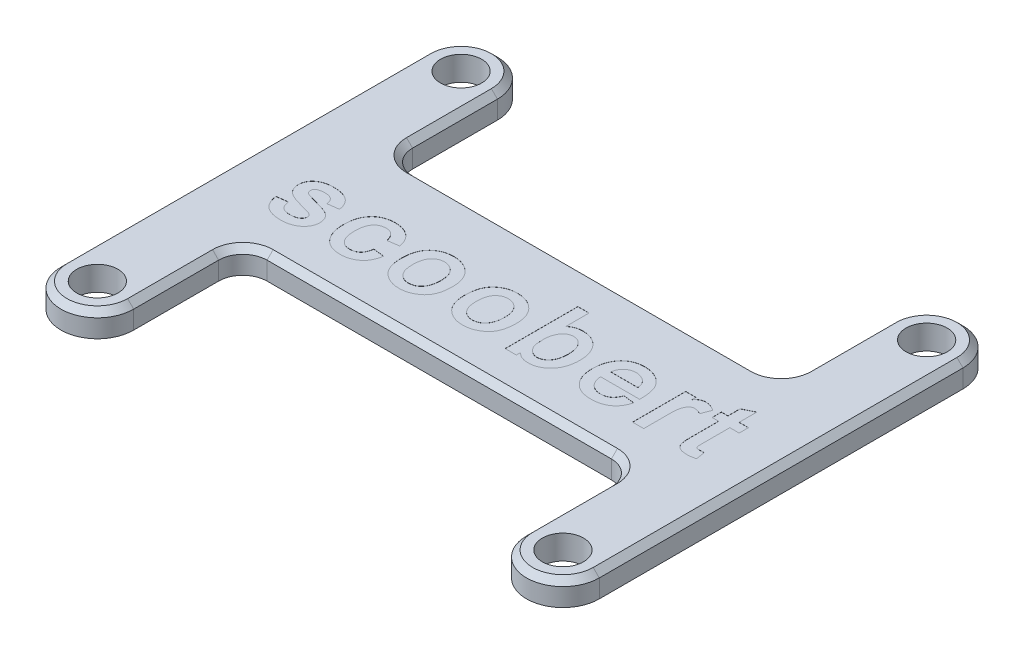
from build123d import *

# Parameters (mm, degrees)
SKETCH1_W            = 32.4
SKETCH1_H            = 12
BOSS_EXTRUDE1_DEPTH  = 2
M3_CLEARANCE_HOLE1_D = 3.4
CUT_EXTRUDE1_START   = -0.01
CUT_EXTRUDE1_DEPTH   = 0.01
FILLET1_R            = 2
CHAMFER1_SIZE        = 0.5


# Read off the part's stored shape, not the designer's step: Cut-Extrude1
with BuildPart() as part:
    # Sketch1 → Boss-Extrude1 (new body)
    with BuildSketch(Plane(origin=(0, 0, 0), x_dir=(1, 0, 0), z_dir=(0, 1, 0))):
        with BuildLine():
            Line((-16.2, 15), (-16.2, -15))
            ThreePointArc((-16.2, -15), (-19.2, -18), (-22.2, -15))
            Line((-22.2, -15), (-22.2, 15))
            ThreePointArc((-22.2, 15), (-19.2, 18), (-16.2, 15))
        make_face()
        with BuildLine():
            Line((22.2, 15), (22.2, -15))
            ThreePointArc((22.2, -15), (19.2, -18), (16.2, -15))
            Line((16.2, -15), (16.2, 15))
            ThreePointArc((16.2, 15), (19.2, 18), (22.2, 15))
        make_face()
        Rectangle(SKETCH1_W, SKETCH1_H)
    extrude(amount=BOSS_EXTRUDE1_DEPTH)

    # M3 Clearance Hole1 (through all)
    with Locations(Plane(origin=(0, 2, 0), x_dir=(1, 0, 0), z_dir=(0, 1, 0))):
        with Locations((-19.2, 15), (-19.2, -15), (19.2, -15), (19.2, 15)):
            Hole(M3_CLEARANCE_HOLE1_D / 2)

    # Cut-Extrude1 outline → Cut-Extrude1 (cut)
    # profile 1 of 8: a face of its own
    with BuildSketch(Plane(origin=(0, 2, 0), x_dir=(1, 0, 0), z_dir=(0, 1, 0)).offset(CUT_EXTRUDE1_START)):
        with BuildLine():
            add(Edge.make_bspline(
                [(18.196153846, -2.986778846), (18.125745356, -3.000612073), (17.993724125, -3.026550417), (17.807185791, -3.053850315), (17.646432842, -3.072291593), (17.547553699, -3.075476527), (17.502644231, -3.076923077)],
                knots=[0, 0, 0, 0, 0.30735575, 0.576315224, 0.807568536, 1, 1, 1, 1], degree=3))
            Line((18.196153846, -2.986778846), (18.079567308, -2.230769231))
            Line((18.079567308, -2.230769231), (17.608413462, -2.230769231))
            add(Edge.make_bspline(
                [(17.35, -1.733173077), (17.350088117, -1.780864019), (17.350247558, -1.867156231), (17.359872664, -1.982899235), (17.373040248, -2.071114025), (17.391420758, -2.137240573), (17.426970141, -2.182261302), (17.47529882, -2.211736815), (17.537730069, -2.227777466), (17.583478919, -2.229713845), (17.608413462, -2.230769231)],
                knots=[0, 0, 0, 0, 0.219094676, 0.396430928, 0.532618118, 0.629836366, 0.707174892, 0.789911788, 0.885495409, 1, 1, 1, 1], degree=3))
            Line((17.35, -1.733173077), (17.35, 0.615384615))
            Line((17.35, 0.615384615), (18.119230769, 0.615384615))
            Line((18.119230769, 0.615384615), (18.119230769, 1.384615385))
            Line((18.119230769, 1.384615385), (17.35, 1.384615385))
            Line((17.35, 1.384615385), (17.35, 2.846153846))
            Line((17.35, 2.846153846), (16.426923077, 2.385817308))
            Line((16.426923077, 2.385817308), (16.426923077, 1.384615385))
            Line((16.426923077, 1.384615385), (15.888461538, 1.384615385))
            Line((15.888461538, 1.384615385), (15.888461538, 0.615384615))
            Line((15.888461538, 0.615384615), (16.426923077, 0.615384615))
            Line((16.426923077, 0.615384615), (16.426923077, -1.717548077))
            add(Edge.make_bspline(
                [(17.502644231, -3.076923077), (17.462565767, -3.076570939), (17.384716784, -3.07588694), (17.271912496, -3.067511798), (17.167585044, -3.053172618), (17.071140805, -3.033908792), (16.982766298, -3.009502197), (16.902955745, -2.977803422), (16.830862594, -2.941863714), (16.747888679, -2.886411622), (16.658077319, -2.807748335), (16.574933149, -2.697606172), (16.510429322, -2.577822429), (16.475048389, -2.441912786), (16.453490797, -2.291036938), (16.438453569, -2.120039462), (16.428964166, -1.926389507), (16.427628013, -1.789676186), (16.426923077, -1.717548077)],
                knots=[0, 0, 0, 0, 0.058671183, 0.113963746, 0.165480639, 0.212762487, 0.257884533, 0.299495549, 0.338321726, 0.37557856, 0.445385773, 0.511909316, 0.576714074, 0.64318846, 0.716195327, 0.799840086, 0.894398322, 1, 1, 1, 1], degree=3))
        make_face()
    # profile 2 of 8: a face of its own
    with BuildSketch(Plane(origin=(0, 2, 0), x_dir=(1, 0, 0), z_dir=(0, 1, 0)).offset(CUT_EXTRUDE1_START)):
        with BuildLine():
            add(Edge.make_bspline(
                [(14.527644231, 1.461538462), (14.562954335, 1.460625021), (14.634261771, 1.458780361), (14.741443108, 1.443191215), (14.849754512, 1.420989186), (14.958833026, 1.387609317), (15.069098393, 1.345965599), (15.180303841, 1.293260605), (15.292859841, 1.232577821), (15.366454674, 1.18594994), (15.403846154, 1.162259615)],
                knots=[0, 0, 0, 0, 0.112759791, 0.227714187, 0.345456957, 0.465733007, 0.591730783, 0.721722568, 0.858615007, 1, 1, 1, 1], degree=3))
            add(Edge.make_bspline(
                [(13.788461545, 1.057067242), (13.819065546, 1.098802401), (13.883267311, 1.179007235), (13.99591758, 1.279282725), (14.115650373, 1.363197003), (14.246423551, 1.418851414), (14.38412589, 1.456368229), (14.479312766, 1.459797326), (14.527644231, 1.461538462)],
                knots=[0.301065936, 0.301065936, 0.301065936, 0.301065936, 0.424683484, 0.54617366, 0.660770063, 0.772803698, 0.884640292, 1, 1, 1, 1], degree=3))
            Line((13.788461545, 1.057067242), (13.788461538, 1.384615385))
            Line((13.788461538, 1.384615385), (12.942307692, 1.384615385))
            Line((12.942307692, 1.384615385), (12.942307692, -3))
            Line((12.942307692, -3), (13.865384615, -3))
            Line((13.865384615, -3), (13.865384615, -0.735576923))
            add(Edge.make_bspline(
                [(14.503605769, 0.538461538), (14.48069565, 0.537560324), (14.435606301, 0.535786645), (14.369313192, 0.520914471), (14.306647495, 0.495329435), (14.247082751, 0.460093777), (14.191479816, 0.414569167), (14.137926664, 0.360311243), (14.089287256, 0.294414214), (14.042111185, 0.220200728), (14.000046604, 0.135709542), (13.964235371, 0.040916338), (13.933090467, -0.063463224), (13.907904458, -0.178363787), (13.889408805, -0.303325854), (13.874719973, -0.438408325), (13.866430779, -0.583628775), (13.865740521, -0.683884031), (13.865384615, -0.735576923)],
                knots=[0, 0, 0, 0, 0.043735157, 0.086075055, 0.128998979, 0.17257982, 0.217764425, 0.265936074, 0.317831173, 0.373893867, 0.43379598, 0.497760804, 0.567260744, 0.641729199, 0.722267439, 0.808483004, 0.901251389, 1, 1, 1, 1], degree=3))
            add(Edge.make_bspline(
                [(15.111778846, 0.384615385), (15.051158748, 0.407865811), (14.938205758, 0.451188161), (14.77577269, 0.500038777), (14.633408989, 0.53138652), (14.544192254, 0.536249343), (14.503605769, 0.538461538)],
                knots=[0, 0, 0, 0, 0.308816844, 0.575416191, 0.806848297, 1, 1, 1, 1], degree=3))
            Line((15.111778846, 0.384615385), (15.403846154, 1.162259615))
        make_face()
    # profile 3 of 8: a face of its own
    with BuildSketch(Plane(origin=(0, 2, 0), x_dir=(1, 0, 0), z_dir=(0, 1, 0)).offset(CUT_EXTRUDE1_START)):
        with BuildLine():
            add(Edge.make_bspline(
                [(9.529807692, 1.461538462), (9.614490114, 1.458558634), (9.783226966, 1.452621076), (10.033546062, 1.411082742), (10.278106145, 1.339883115), (10.476885492, 1.260208874), (10.630590258, 1.180220007), (10.742194258, 1.112063523), (10.84872089, 1.034975674), (10.948849022, 0.947295943), (11.04440842, 0.851727828), (11.135451375, 0.747530563), (11.220619811, 0.63403262), (11.302287288, 0.511011459), (11.376375927, 0.374045925), (11.440553207, 0.220025394), (11.49194286, 0.047221414), (11.537091755, -0.142799525), (11.569133296, -0.3511195), (11.595105755, -0.57676334), (11.608868006, -0.820741997), (11.61062787, -0.989568602), (11.611538462, -1.076923077)],
                knots=[0, 0, 0, 0, 0.067912518, 0.135321409, 0.20285503, 0.271896253, 0.306678357, 0.341729578, 0.376695261, 0.412003314, 0.4483589, 0.485026994, 0.522881184, 0.562096639, 0.603361131, 0.647582606, 0.69566042, 0.74780586, 0.804121275, 0.864589766, 0.929935866, 1, 1, 1, 1], degree=3))
            add(Edge.make_bspline(
                [(7.457692308, -0.838942308), (7.459264578, -0.755949355), (7.46234078, -0.593570656), (7.487705253, -0.355509995), (7.531163465, -0.12981827), (7.589496571, 0.085015007), (7.667129368, 0.28692885), (7.759294313, 0.47849338), (7.870795474, 0.656856516), (7.997799466, 0.822821586), (8.140133029, 0.973170366), (8.297949128, 1.104192318), (8.469540426, 1.215685043), (8.655513303, 1.305692385), (8.854762428, 1.375811982), (9.067406893, 1.42611142), (9.294144169, 1.456607618), (9.449983197, 1.459868275), (9.529807692, 1.461538462)],
                knots=[0, 0, 0, 0, 0.071176592, 0.139259563, 0.205039946, 0.268154111, 0.329935027, 0.390336664, 0.450222865, 0.510022234, 0.569331802, 0.627412013, 0.685557253, 0.744422114, 0.804201731, 0.866382775, 0.931558046, 1, 1, 1, 1], degree=3))
            add(Edge.make_bspline(
                [(9.582692308, -3.076923077), (9.501680554, -3.075086809), (9.343973478, -3.071512111), (9.113833592, -3.043418459), (8.897074757, -2.997279577), (8.694110828, -2.930924117), (8.5046358, -2.846149508), (8.32828354, -2.742903053), (8.166488587, -2.618946621), (8.018208844, -2.47825803), (7.886202696, -2.320824638), (7.771590058, -2.148815788), (7.67335345, -1.963903547), (7.594202382, -1.764665211), (7.533231363, -1.551941342), (7.488844336, -1.326437029), (7.46193097, -1.087193764), (7.459130052, -0.923148642), (7.457692308, -0.838942308)],
                knots=[0, 0, 0, 0, 0.06949348, 0.135284239, 0.198596335, 0.259363704, 0.318141236, 0.376389648, 0.434279905, 0.49263574, 0.551438397, 0.610168664, 0.669679457, 0.730768779, 0.793759027, 0.859287927, 0.9277708, 1, 1, 1, 1], degree=3))
            add(Edge.make_bspline(
                [(11.611538462, -1.573317308), (11.594725922, -1.633263809), (11.56175183, -1.750835659), (11.499389297, -1.919554744), (11.425431292, -2.076300123), (11.342874661, -2.223176203), (11.24721485, -2.357605417), (11.142451343, -2.482400742), (11.026947967, -2.595569084), (10.900954028, -2.696718886), (10.766547248, -2.787771781), (10.62136324, -2.863589261), (10.469794923, -2.931001324), (10.308372091, -2.983212062), (10.138982817, -3.025569839), (9.960924696, -3.055085967), (9.774596889, -3.073715879), (9.647642078, -3.075837606), (9.582692308, -3.076923077)],
                knots=[0, 0, 0, 0, 0.067900411, 0.133171693, 0.195932081, 0.256809188, 0.316710504, 0.375636076, 0.434357073, 0.492784578, 0.551695561, 0.611134311, 0.671220292, 0.73244625, 0.795940402, 0.861540081, 0.929164245, 1, 1, 1, 1], degree=3))
            Line((11.611538462, -1.573317308), (10.713701923, -1.461538462))
            add(Edge.make_bspline(
                [(9.588701923, -2.307692308), (9.654212093, -2.305722996), (9.780380665, -2.301930222), (9.961100914, -2.263327925), (10.125329922, -2.202249315), (10.274834049, -2.115291002), (10.408486557, -1.99786759), (10.526665055, -1.848582918), (10.629978523, -1.66710463), (10.684848805, -1.532381559), (10.713701923, -1.461538462)],
                knots=[0, 0, 0, 0, 0.129297712, 0.249019467, 0.363278463, 0.474354938, 0.588833178, 0.712731131, 0.848941861, 1, 1, 1, 1], degree=3))
            add(Edge.make_bspline(
                [(8.380769231, -1.076923077), (8.385371046, -1.124270639), (8.394383096, -1.216994613), (8.417865823, -1.35194919), (8.452836017, -1.478086238), (8.496984408, -1.595941699), (8.547296758, -1.707049274), (8.610902697, -1.808123475), (8.682234219, -1.901746716), (8.762438663, -1.986731249), (8.849877572, -2.061819445), (8.942145088, -2.127913653), (9.039590518, -2.182681776), (9.140647735, -2.228988383), (9.246354222, -2.263896204), (9.35620192, -2.288973185), (9.470821357, -2.305378051), (9.548981396, -2.306912506), (9.588701923, -2.307692308)],
                knots=[0, 0, 0, 0, 0.074432489, 0.145766241, 0.214065027, 0.278936559, 0.342609268, 0.404551339, 0.465372629, 0.526580499, 0.587038751, 0.645493618, 0.703898024, 0.761703673, 0.819202477, 0.877758134, 0.937877316, 1, 1, 1, 1], degree=3))
            Line((8.380769231, -1.076923077), (11.611538462, -1.076923077))
        make_face()
        with BuildLine():
            add(Edge.make_bspline(
                [(9.551442308, 0.692307692), (9.515751778, 0.69128566), (9.445327865, 0.689269005), (9.341761677, 0.676259109), (9.242583124, 0.652840649), (9.14720905, 0.62212276), (9.056321684, 0.580611326), (8.969845283, 0.530135728), (8.887703147, 0.47054634), (8.809778295, 0.403712691), (8.738613008, 0.329718581), (8.674025885, 0.251365414), (8.61903253, 0.167878375), (8.570408277, 0.080876715), (8.529531756, -0.010338509), (8.497022888, -0.105696905), (8.472711389, -0.205109702), (8.462751473, -0.273137443), (8.457692308, -0.307692308)],
                knots=[0, 0, 0, 0, 0.065886775, 0.130006601, 0.192256692, 0.253764315, 0.314664265, 0.376309564, 0.438295509, 0.501746509, 0.565554231, 0.62757987, 0.688909391, 0.74982281, 0.811397089, 0.873139908, 0.935561094, 1, 1, 1, 1], degree=3))
            add(Edge.make_bspline(
                [(10.688461538, -0.307692308), (10.683892328, -0.267540469), (10.67501287, -0.189512412), (10.651348648, -0.076429116), (10.615781713, 0.0282376), (10.573133537, 0.126292428), (10.519577099, 0.216151115), (10.4565886, 0.297948511), (10.385261923, 0.373845002), (10.277073905, 0.461097017), (10.131712964, 0.552881002), (9.94569467, 0.6331586), (9.751227156, 0.683779015), (9.618249107, 0.689455756), (9.551442308, 0.692307692)],
                knots=[0, 0, 0, 0, 0.072427089, 0.140749346, 0.206615136, 0.270278603, 0.332112927, 0.393595868, 0.455066223, 0.518335486, 0.642279128, 0.761956143, 0.880409223, 1, 1, 1, 1], degree=3))
            Line((10.688461538, -0.307692308), (8.457692308, -0.307692308))
        make_face(mode=Mode.SUBTRACT)
    # profile 4 of 8: a face of its own
    with BuildSketch(Plane(origin=(0, 2, 0), x_dir=(1, 0, 0), z_dir=(0, 1, 0)).offset(CUT_EXTRUDE1_START)):
        with BuildLine():
            add(Edge.make_bspline(
                [(3.357692317, 1.076582455), (3.374429381, 1.093239936), (3.432390212, 1.147530075), (3.53977519, 1.229432137), (3.683335247, 1.3169898), (3.841272086, 1.380828785), (4.009997495, 1.428531112), (4.191332253, 1.4560142), (4.316335076, 1.459664098), (4.380528846, 1.461538462)],
                knots=[0.197370765, 0.197370765, 0.197370765, 0.197370765, 0.247983839, 0.367503663, 0.48664252, 0.60767117, 0.731793492, 0.862265617, 1, 1, 1, 1], degree=3))
            Line((3.357692317, 1.076582455), (3.357692308, 3))
            Line((3.357692308, 3), (2.434615385, 3))
            Line((2.434615385, 3), (2.434615385, -3))
            Line((2.434615385, -3), (3.357692308, -3))
            Line((3.357692308, -3), (3.357692306, -2.639333598))
            add(Edge.make_bspline(
                [(4.378125, -3.076923077), (4.314296359, -3.074846379), (4.189846678, -3.070797344), (4.009085489, -3.039220579), (3.840637468, -2.98602192), (3.683703979, -2.912325767), (3.539206601, -2.816250357), (3.433274157, -2.721080107), (3.375174559, -2.659088756), (3.357692306, -2.639333598)],
                knots=[0, 0, 0, 0, 0.133032983, 0.259380619, 0.381172564, 0.500372988, 0.619690435, 0.741576881, 0.796524826, 0.796524826, 0.796524826, 0.796524826], degree=3))
            add(Edge.make_bspline(
                [(6.357692308, -0.740384615), (6.355716656, -0.829787039), (6.351871547, -1.003786404), (6.325824367, -1.257180701), (6.280063108, -1.495191827), (6.216533261, -1.718606142), (6.134960143, -1.927393478), (6.03493787, -2.120991335), (5.916176847, -2.298937853), (5.780978847, -2.460841429), (5.631552763, -2.603434861), (5.476707464, -2.732124903), (5.311167982, -2.837310223), (5.138994066, -2.924928525), (4.959928887, -2.993872207), (4.772406561, -3.042042343), (4.577783746, -3.071503509), (4.445135278, -3.075104139), (4.378125, -3.076923077)],
                knots=[0, 0, 0, 0, 0.078111, 0.152023445, 0.222254175, 0.289618252, 0.354686773, 0.417781959, 0.479625708, 0.541252118, 0.601655497, 0.65987939, 0.716877111, 0.772608504, 0.828451916, 0.884148121, 0.941474886, 1, 1, 1, 1], degree=3))
            add(Edge.make_bspline(
                [(4.380528846, 1.461538462), (4.455137884, 1.459736632), (4.601329369, 1.456206067), (4.814525716, 1.427280976), (5.015207974, 1.378101447), (5.203354892, 1.30888856), (5.379549547, 1.221287219), (5.543509804, 1.11325721), (5.694282532, 0.984805275), (5.831801917, 0.838307306), (5.955067601, 0.677212182), (6.063968913, 0.505529489), (6.153815062, 0.322469976), (6.229550536, 0.13024977), (6.2861602, -0.073372957), (6.328928835, -0.286557163), (6.3526848, -0.510277212), (6.355999748, -0.662607287), (6.357692308, -0.740384615)],
                knots=[0, 0, 0, 0, 0.067186761, 0.131648023, 0.193355222, 0.252954891, 0.311863299, 0.370217491, 0.42936419, 0.48986931, 0.55086323, 0.611840065, 0.672685402, 0.734274295, 0.797676238, 0.862789823, 0.929942653, 1, 1, 1, 1], degree=3))
        make_face()
        with BuildLine():
            add(Edge.make_bspline(
                [(3.357692308, -0.775240385), (3.358215846, -0.827730047), (3.359227306, -0.929138549), (3.365160912, -1.075041488), (3.374618763, -1.20853497), (3.387392205, -1.329748968), (3.405210268, -1.438481007), (3.426805013, -1.535211251), (3.45121021, -1.620085037), (3.491505752, -1.715734892), (3.552565007, -1.821275707), (3.634858553, -1.938636685), (3.734259306, -2.041549267), (3.841384087, -2.13578245), (3.960371518, -2.211065059), (4.084930324, -2.267759708), (4.215316124, -2.301389134), (4.303821507, -2.305591164), (4.348076923, -2.307692308)],
                knots=[0, 0, 0, 0, 0.076848547, 0.148469156, 0.213746393, 0.272756373, 0.32685378, 0.374951845, 0.417819038, 0.455945553, 0.526591556, 0.595937447, 0.665233707, 0.735535528, 0.804365996, 0.87053318, 0.935262604, 1, 1, 1, 1], degree=3))
            add(Edge.make_bspline(
                [(4.372115385, 0.692307692), (4.337160859, 0.691311161), (4.268300906, 0.689348008), (4.167412795, 0.668959756), (4.070585363, 0.637607588), (3.977243401, 0.594354491), (3.888791088, 0.536744195), (3.804631861, 0.466827811), (3.725241641, 0.384011494), (3.649457212, 0.290973034), (3.581992907, 0.186552298), (3.52068308, 0.074198043), (3.471273899, -0.047590131), (3.428308893, -0.177021334), (3.396546103, -0.315108117), (3.373663129, -0.461296965), (3.360621824, -0.615547687), (3.358684952, -0.721129744), (3.357692308, -0.775240385)],
                knots=[0, 0, 0, 0, 0.052838328, 0.104090807, 0.155095211, 0.20663382, 0.259276966, 0.314396929, 0.371855118, 0.432649243, 0.495714076, 0.559736443, 0.626060352, 0.694321033, 0.765945785, 0.840211496, 0.918108639, 1, 1, 1, 1], degree=3))
            add(Edge.make_bspline(
                [(5.434615385, -0.801682692), (5.433669889, -0.745163199), (5.431829856, -0.635170476), (5.418209634, -0.474662791), (5.397431046, -0.323515152), (5.366192211, -0.181561462), (5.32462669, -0.049441719), (5.277838673, 0.074896557), (5.219243568, 0.189012281), (5.152246852, 0.293149068), (5.078230011, 0.387028906), (4.996932662, 0.468779306), (4.9086709, 0.537399656), (4.814360354, 0.595034387), (4.712446545, 0.63804827), (4.604757659, 0.669270007), (4.490654748, 0.689434162), (4.412266505, 0.691334383), (4.372115385, 0.692307692)],
                knots=[0, 0, 0, 0, 0.082299418, 0.160163098, 0.234424044, 0.304352796, 0.371528034, 0.435995859, 0.497576692, 0.557943234, 0.616077722, 0.67136087, 0.725398462, 0.778530785, 0.831851775, 0.88594918, 0.941582205, 1, 1, 1, 1], degree=3))
            add(Edge.make_bspline(
                [(4.348076923, -2.307692308), (4.386200608, -2.306542385), (4.461284406, -2.304277636), (4.571672121, -2.286173924), (4.676508241, -2.254134887), (4.777542342, -2.212357908), (4.872667181, -2.15661191), (4.962277412, -2.088036019), (5.047775953, -2.008858383), (5.127358765, -1.917112406), (5.198808682, -1.813643507), (5.263552009, -1.700468052), (5.315593643, -1.575246041), (5.360566265, -1.440932538), (5.39370469, -1.29551654), (5.417490906, -1.140072397), (5.432027458, -0.974234464), (5.43373765, -0.860206234), (5.434615385, -0.801682692)],
                knots=[0, 0, 0, 0, 0.054953583, 0.108229926, 0.16068253, 0.212716771, 0.265524431, 0.319131706, 0.375128909, 0.433274838, 0.493849233, 0.556185598, 0.620886011, 0.689022871, 0.760203991, 0.83561231, 0.915630105, 1, 1, 1, 1], degree=3))
        make_face(mode=Mode.SUBTRACT)
    # profile 5 of 8: a face of its own
    with BuildSketch(Plane(origin=(0, 2, 0), x_dir=(1, 0, 0), z_dir=(0, 1, 0)).offset(CUT_EXTRUDE1_START)):
        with BuildLine():
            add(Edge.make_bspline(
                [(-3.05, -0.807692308), (-3.048202398, -0.715470583), (-3.044723629, -0.537000553), (-3.016612186, -0.27816859), (-2.971527436, -0.037235684), (-2.908736849, 0.186348205), (-2.824920372, 0.391174627), (-2.724086932, 0.578682002), (-2.604409795, 0.748361999), (-2.466823474, 0.899072942), (-2.314776114, 1.029673456), (-2.156274509, 1.147257247), (-1.985838622, 1.242947249), (-1.808687321, 1.324381961), (-1.621715881, 1.385339691), (-1.427153137, 1.430203507), (-1.223433454, 1.457127532), (-1.084535943, 1.460052081), (-1.013942308, 1.461538462)],
                knots=[0, 0, 0, 0, 0.080214474, 0.155233265, 0.226189928, 0.293265234, 0.356890246, 0.418338542, 0.478103057, 0.537069476, 0.595367677, 0.652256829, 0.708458474, 0.76508328, 0.821626501, 0.8792055, 0.938607086, 1, 1, 1, 1], degree=3))
            add(Edge.make_bspline(
                [(-1.013942308, -3.076923077), (-1.081325277, -3.07531706), (-1.214568968, -3.072141307), (-1.411051074, -3.046557888), (-1.600560847, -3.003239022), (-1.782858337, -2.942310577), (-1.959396645, -2.867051012), (-2.128680777, -2.772324506), (-2.290374397, -2.659849533), (-2.446580991, -2.533557499), (-2.588837551, -2.386709795), (-2.71380915, -2.219433218), (-2.81835766, -2.031602687), (-2.903706408, -1.824579322), (-2.969823591, -1.598094896), (-3.015391183, -1.352036573), (-3.045103921, -1.086460436), (-3.048330832, -0.902729734), (-3.05, -0.807692308)],
                knots=[0, 0, 0, 0, 0.05861417, 0.115904189, 0.172053382, 0.227501335, 0.282931753, 0.338797808, 0.395943413, 0.454145652, 0.513311791, 0.573339393, 0.635300473, 0.699843563, 0.767791173, 0.840191686, 0.917336783, 1, 1, 1, 1], degree=3))
            add(Edge.make_bspline(
                [(1.103846154, -0.740384615), (1.102230938, -0.841023688), (1.099114893, -1.035174769), (1.068853562, -1.315456453), (1.018855088, -1.573287776), (0.949896318, -1.810398895), (0.858157099, -2.024522967), (0.748767775, -2.218737998), (0.617023861, -2.389415442), (0.465213118, -2.536080791), (0.301315367, -2.662095984), (0.13198665, -2.773973231), (-0.044701083, -2.865863505), (-0.225873937, -2.944889482), (-0.415013533, -3.00229906), (-0.60920433, -3.046650638), (-0.809738129, -3.072101935), (-0.945363991, -3.075303983), (-1.013942308, -3.076923077)],
                knots=[0, 0, 0, 0, 0.084484379, 0.162985737, 0.236353139, 0.304795452, 0.369908212, 0.431540194, 0.491496675, 0.550258625, 0.608267478, 0.664907113, 0.720436851, 0.775301219, 0.830631879, 0.886133075, 0.942423945, 1, 1, 1, 1], degree=3))
            add(Edge.make_bspline(
                [(-1.013942308, 1.461538462), (-0.937733817, 1.459684854), (-0.788407709, 1.456052818), (-0.569962428, 1.427777764), (-0.362284133, 1.382349079), (-0.165031562, 1.318800361), (0.020920779, 1.23531726), (0.196212834, 1.133408961), (0.36193623, 1.014588661), (0.513876111, 0.875559588), (0.65342425, 0.722980922), (0.774831946, 0.554587092), (0.875421779, 0.371478756), (0.960352415, 0.176284025), (1.025372235, -0.033305038), (1.070248039, -0.256855692), (1.098420364, -0.494074528), (1.102008674, -0.656970089), (1.103846154, -0.740384615)],
                knots=[0, 0, 0, 0, 0.066337385, 0.12998425, 0.19143073, 0.251221099, 0.310087466, 0.368543103, 0.427505515, 0.487271456, 0.547530124, 0.607262461, 0.667538292, 0.729099525, 0.792319563, 0.858201382, 0.927388662, 1, 1, 1, 1], degree=3))
        make_face()
        with BuildLine():
            add(Edge.make_bspline(
                [(-2.126923077, -0.810096154), (-2.126153018, -0.872630318), (-2.124664564, -0.993503149), (-2.10897415, -1.168237144), (-2.082788391, -1.329736114), (-2.046616257, -1.478406612), (-2.002041436, -1.615257883), (-1.943791794, -1.738222534), (-1.876264998, -1.848838439), (-1.798973621, -1.946324428), (-1.714744985, -2.03170794), (-1.625831002, -2.105019443), (-1.533095398, -2.167165431), (-1.437288277, -2.219226315), (-1.336836005, -2.259248003), (-1.232267673, -2.286776801), (-1.124287149, -2.304010146), (-1.050864633, -2.306460225), (-1.013942308, -2.307692308)],
                knots=[0, 0, 0, 0, 0.089397978, 0.17279813, 0.250591186, 0.323120504, 0.39141776, 0.4559979, 0.517209873, 0.576349402, 0.63346772, 0.688407064, 0.740840056, 0.792870919, 0.844039973, 0.89503878, 0.947217659, 1, 1, 1, 1], degree=3))
            add(Edge.make_bspline(
                [(-1.013942308, 0.692307692), (-1.05206771, 0.691110208), (-1.127091828, 0.688753768), (-1.237070795, 0.671405092), (-1.3427925, 0.643813591), (-1.444265859, 0.60420326), (-1.540413629, 0.551337153), (-1.634004072, 0.490401369), (-1.721903383, 0.416176261), (-1.805032216, 0.330926101), (-1.881055989, 0.233372105), (-1.947712527, 0.122522859), (-2.004221135, -0.001123412), (-2.04766402, -0.138747052), (-2.084422421, -0.287924898), (-2.108411762, -0.450506785), (-2.12484936, -0.625862884), (-2.126214591, -0.747152824), (-2.126923077, -0.810096154)],
                knots=[0, 0, 0, 0, 0.054278405, 0.106810398, 0.158154632, 0.209647648, 0.261468368, 0.314164326, 0.368442731, 0.424931244, 0.483479906, 0.54414757, 0.608744656, 0.676586364, 0.749377187, 0.827329395, 0.910392709, 1, 1, 1, 1], degree=3))
            add(Edge.make_bspline(
                [(0.180769231, -0.782451923), (0.180166659, -0.722701885), (0.178999317, -0.606950045), (0.160899108, -0.439239327), (0.136014255, -0.282491735), (0.09694479, -0.137950921), (0.04905876, -0.004510495), (-0.009450299, 0.117884249), (-0.080906015, 0.227539733), (-0.161987167, 0.325543637), (-0.250782214, 0.411508776), (-0.344702316, 0.486910445), (-0.444546363, 0.549176901), (-0.54770668, 0.603647446), (-0.657826508, 0.642158508), (-0.771834479, 0.671973485), (-0.891258928, 0.688604002), (-0.972629019, 0.691060485), (-1.013942308, 0.692307692)],
                knots=[0, 0, 0, 0, 0.083682389, 0.16211522, 0.236138141, 0.305863357, 0.37157641, 0.434601155, 0.495489189, 0.55450556, 0.61247111, 0.668411082, 0.722924216, 0.777159101, 0.831504297, 0.885971154, 0.942105183, 1, 1, 1, 1], degree=3))
            add(Edge.make_bspline(
                [(-1.013942308, -2.307692308), (-0.966584955, -2.306812333), (-0.874200559, -2.305095685), (-0.740484489, -2.28383551), (-0.615379588, -2.251060294), (-0.497975399, -2.207971267), (-0.391389181, -2.146992279), (-0.291855163, -2.076629081), (-0.202262331, -1.991131614), (-0.122148753, -1.893271634), (-0.050015712, -1.78560141), (0.011291153, -1.667489057), (0.06413366, -1.541331844), (0.107748799, -1.406351363), (0.139319944, -1.262488841), (0.163697984, -1.110456995), (0.178129856, -0.949397174), (0.179875671, -0.838971227), (0.180769231, -0.782451923)],
                knots=[0, 0, 0, 0, 0.064755906, 0.126325373, 0.184706984, 0.241628563, 0.296853328, 0.352241158, 0.408091114, 0.465726471, 0.525032764, 0.585119602, 0.647540082, 0.712042485, 0.778946965, 0.848895994, 0.922660449, 1, 1, 1, 1], degree=3))
        make_face(mode=Mode.SUBTRACT)
    # profile 6 of 8: a face of its own
    with BuildSketch(Plane(origin=(0, 2, 0), x_dir=(1, 0, 0), z_dir=(0, 1, 0)).offset(CUT_EXTRUDE1_START)):
        with BuildLine():
            add(Edge.make_bspline(
                [(-8.303846154, -0.807692308), (-8.302048552, -0.715470583), (-8.298569783, -0.537000553), (-8.270458339, -0.27816859), (-8.22537359, -0.037235684), (-8.162583003, 0.186348205), (-8.078766526, 0.391174627), (-7.977933086, 0.578682002), (-7.858255948, 0.748361999), (-7.720669628, 0.899072942), (-7.568622268, 1.029673456), (-7.410120663, 1.147257247), (-7.239684776, 1.242947249), (-7.062533474, 1.324381961), (-6.875562035, 1.385339691), (-6.680999291, 1.430203507), (-6.477279608, 1.457127532), (-6.338382097, 1.460052081), (-6.267788462, 1.461538462)],
                knots=[0, 0, 0, 0, 0.080214474, 0.155233265, 0.226189928, 0.293265234, 0.356890246, 0.418338542, 0.478103057, 0.537069476, 0.595367677, 0.652256829, 0.708458474, 0.76508328, 0.821626501, 0.8792055, 0.938607086, 1, 1, 1, 1], degree=3))
            add(Edge.make_bspline(
                [(-6.267788462, -3.076923077), (-6.335171431, -3.07531706), (-6.468415122, -3.072141307), (-6.664897228, -3.046557888), (-6.854407001, -3.003239022), (-7.036704491, -2.942310577), (-7.213242799, -2.867051012), (-7.38252693, -2.772324506), (-7.544220551, -2.659849533), (-7.700427144, -2.533557499), (-7.842683704, -2.386709795), (-7.967655304, -2.219433218), (-8.072203814, -2.031602687), (-8.157552562, -1.824579322), (-8.223669744, -1.598094896), (-8.269237337, -1.352036573), (-8.298950075, -1.086460436), (-8.302176986, -0.902729734), (-8.303846154, -0.807692308)],
                knots=[0, 0, 0, 0, 0.05861417, 0.115904189, 0.172053382, 0.227501335, 0.282931753, 0.338797808, 0.395943413, 0.454145652, 0.513311791, 0.573339393, 0.635300473, 0.699843563, 0.767791173, 0.840191686, 0.917336783, 1, 1, 1, 1], degree=3))
            add(Edge.make_bspline(
                [(-4.15, -0.740384615), (-4.151615216, -0.841023688), (-4.154731261, -1.035174769), (-4.184992592, -1.315456453), (-4.234991066, -1.573287776), (-4.303949836, -1.810398895), (-4.395689055, -2.024522967), (-4.505078379, -2.218737998), (-4.636822293, -2.389415442), (-4.788633036, -2.536080791), (-4.952530787, -2.662095984), (-5.121859504, -2.773973231), (-5.298547236, -2.865863505), (-5.479720091, -2.944889482), (-5.668859687, -3.00229906), (-5.863050484, -3.046650638), (-6.063584283, -3.072101935), (-6.199210145, -3.075303983), (-6.267788462, -3.076923077)],
                knots=[0, 0, 0, 0, 0.084484379, 0.162985737, 0.236353139, 0.304795452, 0.369908212, 0.431540194, 0.491496675, 0.550258625, 0.608267478, 0.664907113, 0.720436851, 0.775301219, 0.830631879, 0.886133075, 0.942423945, 1, 1, 1, 1], degree=3))
            add(Edge.make_bspline(
                [(-6.267788462, 1.461538462), (-6.191579971, 1.459684854), (-6.042253863, 1.456052818), (-5.823808582, 1.427777764), (-5.616130287, 1.382349079), (-5.418877716, 1.318800361), (-5.232925375, 1.23531726), (-5.05763332, 1.133408961), (-4.891909924, 1.014588661), (-4.739970043, 0.875559588), (-4.600421904, 0.722980922), (-4.479014207, 0.554587092), (-4.378424375, 0.371478756), (-4.293493739, 0.176284025), (-4.228473919, -0.033305038), (-4.183598115, -0.256855692), (-4.15542579, -0.494074528), (-4.151837479, -0.656970089), (-4.15, -0.740384615)],
                knots=[0, 0, 0, 0, 0.066337385, 0.12998425, 0.19143073, 0.251221099, 0.310087466, 0.368543103, 0.427505515, 0.487271456, 0.547530124, 0.607262461, 0.667538292, 0.729099525, 0.792319563, 0.858201382, 0.927388662, 1, 1, 1, 1], degree=3))
        make_face()
        with BuildLine():
            add(Edge.make_bspline(
                [(-7.380769231, -0.810096154), (-7.379999172, -0.872630318), (-7.378510718, -0.993503149), (-7.362820304, -1.168237144), (-7.336634545, -1.329736114), (-7.30046241, -1.478406612), (-7.25588759, -1.615257883), (-7.197637948, -1.738222534), (-7.130111152, -1.848838439), (-7.052819775, -1.946324428), (-6.968591138, -2.03170794), (-6.879677156, -2.105019443), (-6.786941552, -2.167165431), (-6.69113443, -2.219226315), (-6.590682159, -2.259248003), (-6.486113827, -2.286776801), (-6.378133303, -2.304010146), (-6.304710786, -2.306460225), (-6.267788462, -2.307692308)],
                knots=[0, 0, 0, 0, 0.089397978, 0.17279813, 0.250591186, 0.323120504, 0.39141776, 0.4559979, 0.517209873, 0.576349402, 0.63346772, 0.688407064, 0.740840056, 0.792870919, 0.844039973, 0.89503878, 0.947217659, 1, 1, 1, 1], degree=3))
            add(Edge.make_bspline(
                [(-6.267788462, 0.692307692), (-6.305913864, 0.691110208), (-6.380937982, 0.688753768), (-6.490916949, 0.671405092), (-6.596638654, 0.643813591), (-6.698112013, 0.60420326), (-6.794259783, 0.551337153), (-6.887850226, 0.490401369), (-6.975749537, 0.416176261), (-7.05887837, 0.330926101), (-7.134902143, 0.233372105), (-7.20155868, 0.122522859), (-7.258067289, -0.001123412), (-7.301510174, -0.138747052), (-7.338268575, -0.287924898), (-7.362257916, -0.450506785), (-7.378695514, -0.625862884), (-7.380060745, -0.747152824), (-7.380769231, -0.810096154)],
                knots=[0, 0, 0, 0, 0.054278405, 0.106810398, 0.158154632, 0.209647648, 0.261468368, 0.314164326, 0.368442731, 0.424931244, 0.483479906, 0.54414757, 0.608744656, 0.676586364, 0.749377187, 0.827329395, 0.910392709, 1, 1, 1, 1], degree=3))
            add(Edge.make_bspline(
                [(-5.073076923, -0.782451923), (-5.073679494, -0.722701885), (-5.074846837, -0.606950045), (-5.092947046, -0.439239327), (-5.117831899, -0.282491735), (-5.156901364, -0.137950921), (-5.204787394, -0.004510495), (-5.263296453, 0.117884249), (-5.334752169, 0.227539733), (-5.415833321, 0.325543637), (-5.504628368, 0.411508776), (-5.59854847, 0.486910445), (-5.698392516, 0.549176901), (-5.801552834, 0.603647446), (-5.911672662, 0.642158508), (-6.025680633, 0.671973485), (-6.145105082, 0.688604002), (-6.226475173, 0.691060485), (-6.267788462, 0.692307692)],
                knots=[0, 0, 0, 0, 0.083682389, 0.16211522, 0.236138141, 0.305863357, 0.37157641, 0.434601155, 0.495489189, 0.55450556, 0.61247111, 0.668411082, 0.722924216, 0.777159101, 0.831504297, 0.885971154, 0.942105183, 1, 1, 1, 1], degree=3))
            add(Edge.make_bspline(
                [(-6.267788462, -2.307692308), (-6.220431109, -2.306812333), (-6.128046713, -2.305095685), (-5.994330642, -2.28383551), (-5.869225742, -2.251060294), (-5.751821552, -2.207971267), (-5.645235335, -2.146992279), (-5.545701317, -2.076629081), (-5.456108485, -1.991131614), (-5.375994907, -1.893271634), (-5.303861865, -1.78560141), (-5.242555001, -1.667489057), (-5.189712494, -1.541331844), (-5.146097355, -1.406351363), (-5.11452621, -1.262488841), (-5.090148169, -1.110456995), (-5.075716298, -0.949397174), (-5.073970483, -0.838971227), (-5.073076923, -0.782451923)],
                knots=[0, 0, 0, 0, 0.064755906, 0.126325373, 0.184706984, 0.241628563, 0.296853328, 0.352241158, 0.408091114, 0.465726471, 0.525032764, 0.585119602, 0.647540082, 0.712042485, 0.778946965, 0.848895994, 0.922660449, 1, 1, 1, 1], degree=3))
        make_face(mode=Mode.SUBTRACT)
    # profile 7 of 8: a face of its own
    with BuildSketch(Plane(origin=(0, 2, 0), x_dir=(1, 0, 0), z_dir=(0, 1, 0)).offset(CUT_EXTRUDE1_START)):
        with BuildLine():
            add(Edge.make_bspline(
                [(-9.173076923, -1.412259615), (-9.186114305, -1.48218163), (-9.211572949, -1.618721282), (-9.265267278, -1.814818691), (-9.332893701, -1.995441106), (-9.411121078, -2.162079192), (-9.502454826, -2.314315596), (-9.607298717, -2.451349367), (-9.723471856, -2.574690463), (-9.852794634, -2.680804783), (-9.989546364, -2.774255259), (-10.132350455, -2.855315005), (-10.279840372, -2.923787297), (-10.432679752, -2.979467012), (-10.590666384, -3.02287464), (-10.753882194, -3.053568037), (-10.922161535, -3.073967251), (-11.035996843, -3.075928207), (-11.09375, -3.076923077)],
                knots=[0, 0, 0, 0, 0.076198306, 0.148795628, 0.21753543, 0.282636842, 0.345809937, 0.407376868, 0.467200697, 0.52695208, 0.586254488, 0.644511126, 0.702712371, 0.76029916, 0.818625363, 0.878070571, 0.938140375, 1, 1, 1, 1], degree=3))
            Line((-9.173076923, -1.412259615), (-10.085336538, -1.307692308))
            add(Edge.make_bspline(
                [(-11.109375, -2.307692308), (-11.073288534, -2.307038905), (-11.002948917, -2.305765294), (-10.900471621, -2.294749796), (-10.803934851, -2.276957414), (-10.713400832, -2.251689432), (-10.629010247, -2.21960258), (-10.551152071, -2.179146673), (-10.478802591, -2.132414217), (-10.411986423, -2.077899963), (-10.351157507, -2.014779275), (-10.297036451, -1.94166266), (-10.247762097, -1.859455513), (-10.203212371, -1.767891635), (-10.164847227, -1.66646015), (-10.132996795, -1.555330835), (-10.104801413, -1.435103527), (-10.091963614, -1.351071155), (-10.085336538, -1.307692308)],
                knots=[0, 0, 0, 0, 0.067533993, 0.131637031, 0.192679448, 0.251089821, 0.307356905, 0.361359317, 0.41502741, 0.468322165, 0.522423431, 0.578670518, 0.638220458, 0.701613252, 0.769026377, 0.840932755, 0.917886957, 1, 1, 1, 1], degree=3))
            add(Edge.make_bspline(
                [(-12.173076923, -0.801682692), (-12.172150147, -0.863008567), (-12.170360943, -0.981402286), (-12.156770701, -1.153121056), (-12.13606847, -1.312686531), (-12.104885839, -1.460665158), (-12.06373344, -1.596198079), (-12.016389992, -1.721172583), (-11.958590656, -1.833847018), (-11.890952799, -1.933776641), (-11.816309917, -2.022014606), (-11.734846048, -2.098573507), (-11.647237241, -2.164465772), (-11.551293626, -2.215500962), (-11.450393237, -2.257143762), (-11.342878624, -2.28765691), (-11.228067815, -2.303986609), (-11.149486631, -2.306439986), (-11.109375, -2.307692308)],
                knots=[0, 0, 0, 0, 0.088240555, 0.170354316, 0.247733021, 0.319650297, 0.387684301, 0.451388562, 0.511727127, 0.569453015, 0.624671455, 0.677694208, 0.730045061, 0.781901501, 0.833613516, 0.886911389, 0.942274112, 1, 1, 1, 1], degree=3))
            add(Edge.make_bspline(
                [(-11.079326923, 0.692307692), (-11.121473948, 0.691275937), (-11.203371275, 0.689271097), (-11.322450627, 0.670145397), (-11.434458619, 0.64223291), (-11.539619407, 0.600793434), (-11.636878321, 0.546292426), (-11.727591369, 0.480955915), (-11.811780156, 0.404536378), (-11.887023365, 0.315224717), (-11.954883359, 0.214591679), (-12.013732474, 0.102559896), (-12.062567075, -0.020981003), (-12.103928112, -0.155058321), (-12.134218872, -0.300835766), (-12.157365351, -0.457707609), (-12.170143781, -0.625990435), (-12.172079986, -0.741967166), (-12.173076923, -0.801682692)],
                knots=[0, 0, 0, 0, 0.060261633, 0.117096444, 0.172157297, 0.225171667, 0.278291316, 0.331271579, 0.384834824, 0.440548361, 0.497947047, 0.558208679, 0.621229359, 0.687780632, 0.758729686, 0.834046637, 0.91455189, 1, 1, 1, 1], degree=3))
            add(Edge.make_bspline(
                [(-10.152644231, -0.153846154), (-10.163196592, -0.117308804), (-10.183733224, -0.046201105), (-10.217909106, 0.055700213), (-10.25670641, 0.14917065), (-10.299060756, 0.234327886), (-10.342482797, 0.312809355), (-10.391485791, 0.381916312), (-10.442761686, 0.443651491), (-10.516515427, 0.513938505), (-10.619288776, 0.585949276), (-10.758552329, 0.648484161), (-10.913882451, 0.686260818), (-11.023021245, 0.690249761), (-11.079326923, 0.692307692)],
                knots=[0, 0, 0, 0, 0.083150449, 0.161824464, 0.234869099, 0.304211264, 0.369729687, 0.430729471, 0.489165704, 0.544927521, 0.65307669, 0.761679019, 0.877048079, 1, 1, 1, 1], degree=3))
            Line((-10.152644231, -0.153846154), (-9.25, -0.022836538))
            add(Edge.make_bspline(
                [(-11.09375, 1.461538462), (-11.034427029, 1.460268161), (-10.917942724, 1.457773847), (-10.746543218, 1.441584618), (-10.583073781, 1.410362583), (-10.425303, 1.371851696), (-10.275378425, 1.318167132), (-10.13142233, 1.254812895), (-9.994925893, 1.178294041), (-9.86555127, 1.09107023), (-9.74458965, 0.99274667), (-9.636196363, 0.88182222), (-9.540392039, 0.759209851), (-9.457170399, 0.624944859), (-9.386360337, 0.478978269), (-9.327713842, 0.321974089), (-9.279779727, 0.15411641), (-9.260087156, 0.037101954), (-9.25, -0.022836538)],
                knots=[0, 0, 0, 0, 0.068173727, 0.13386331, 0.197522766, 0.259269093, 0.320276455, 0.380248456, 0.439809102, 0.499821731, 0.559357463, 0.618607719, 0.677639372, 0.737808952, 0.799783117, 0.863741508, 0.930204106, 1, 1, 1, 1], degree=3))
            add(Edge.make_bspline(
                [(-13.096153846, -0.816105769), (-13.095310423, -0.74796598), (-13.093661288, -0.614733097), (-13.078472234, -0.419841138), (-13.056628334, -0.235105007), (-13.02399758, -0.060861286), (-12.982054495, 0.103029283), (-12.930774617, 0.257133668), (-12.86920142, 0.400399551), (-12.799613346, 0.533703514), (-12.720272455, 0.655271303), (-12.639931923, 0.770654911), (-12.550825648, 0.873483047), (-12.460012201, 0.969798502), (-12.362285068, 1.054476952), (-12.260920298, 1.131424723), (-12.153913855, 1.197140051), (-12.006073191, 1.272173363), (-11.814825737, 1.347011454), (-11.579276816, 1.414577005), (-11.337834086, 1.453497006), (-11.17521207, 1.458854658), (-11.09375, 1.461538462)],
                knots=[0, 0, 0, 0, 0.059491985, 0.116323939, 0.170610276, 0.221867466, 0.270998264, 0.318239191, 0.363534401, 0.407040512, 0.449355739, 0.490229045, 0.529694603, 0.568046547, 0.605730441, 0.642465323, 0.679068356, 0.715212056, 0.787130235, 0.858013862, 0.928875037, 1, 1, 1, 1], degree=3))
            add(Edge.make_bspline(
                [(-11.09375, -3.076923077), (-11.171559203, -3.075151607), (-11.322934084, -3.071705278), (-11.543365487, -3.04279821), (-11.749638414, -2.992990467), (-11.943518663, -2.926621209), (-12.122714526, -2.837748737), (-12.288557142, -2.730150665), (-12.44099071, -2.603345909), (-12.578040175, -2.456912692), (-12.700016387, -2.295039745), (-12.806398196, -2.119900776), (-12.895354405, -1.93235591), (-12.968941993, -1.732853167), (-13.026591964, -1.520939069), (-13.067077504, -1.296550652), (-13.091275486, -1.060228536), (-13.094503435, -0.898695603), (-13.096153846, -0.816105769)],
                knots=[0, 0, 0, 0, 0.068298334, 0.132871842, 0.194726616, 0.254354938, 0.312402927, 0.369869291, 0.42756236, 0.486039333, 0.545556537, 0.605219088, 0.665635899, 0.727514673, 0.791684533, 0.858194939, 0.927496788, 1, 1, 1, 1], degree=3))
        make_face()
    # profile 8 of 8: a face of its own
    with BuildSketch(Plane(origin=(0, 2, 0), x_dir=(1, 0, 0), z_dir=(0, 1, 0)).offset(CUT_EXTRUDE1_START)):
        with BuildLine():
            add(Edge.make_bspline(
                [(-15.262259615, 0), (-15.27286884, 0.058930461), (-15.292904045, 0.170218877), (-15.348717353, 0.321219034), (-15.425655595, 0.445074037), (-15.525054514, 0.540948157), (-15.646262141, 0.610102725), (-15.786679884, 0.659287318), (-15.949039411, 0.687579638), (-16.06422692, 0.690670499), (-16.125240385, 0.692307692)],
                knots=[0, 0, 0, 0, 0.144598555, 0.273070054, 0.386754898, 0.494326969, 0.603324873, 0.721606192, 0.852538083, 1, 1, 1, 1], degree=3))
            Line((-15.262259615, 0), (-14.35, 0.117788462))
            add(Edge.make_bspline(
                [(-16.180528846, 1.461538462), (-16.113993451, 1.460743015), (-15.984332967, 1.459192894), (-15.795200285, 1.443478715), (-15.617484126, 1.416878098), (-15.450542942, 1.382193395), (-15.296280698, 1.332425418), (-15.151044751, 1.277704083), (-15.018780581, 1.208318973), (-14.897099359, 1.130085044), (-14.787739806, 1.040370333), (-14.687464711, 0.942121098), (-14.602841802, 0.829959008), (-14.526783932, 0.70921425), (-14.465415337, 0.576187906), (-14.412501779, 0.433564734), (-14.374869524, 0.279296255), (-14.358411642, 0.172415395), (-14.35, 0.117788462)],
                knots=[0, 0, 0, 0, 0.07888893, 0.153734366, 0.224821267, 0.291915944, 0.355628507, 0.416857015, 0.475717248, 0.532381358, 0.588105552, 0.643200374, 0.698411833, 0.754311952, 0.812117759, 0.87178543, 0.934469382, 1, 1, 1, 1], degree=3))
            add(Edge.make_bspline(
                [(-17.811538462, 0.180288462), (-17.810100788, 0.226037736), (-17.807273801, 0.31599736), (-17.786489278, 0.447916522), (-17.751950764, 0.573594804), (-17.701738104, 0.692214493), (-17.63909294, 0.805140041), (-17.561235578, 0.910972952), (-17.470879727, 1.011562015), (-17.36593664, 1.103593732), (-17.249963137, 1.187210462), (-17.124082839, 1.260993161), (-16.989039885, 1.323908477), (-16.844182811, 1.373719823), (-16.691200497, 1.413855959), (-16.529054288, 1.440847896), (-16.357984475, 1.45807715), (-16.240668446, 1.460365425), (-16.180528846, 1.461538462)],
                knots=[0, 0, 0, 0, 0.05906214, 0.116137535, 0.171997035, 0.226958009, 0.282084324, 0.338380577, 0.396257004, 0.456365845, 0.518254107, 0.580633484, 0.644520129, 0.710297735, 0.778186044, 0.848527827, 0.922350969, 1, 1, 1, 1], degree=3))
            add(Edge.make_bspline(
                [(-16.285096154, -1.155048077), (-16.358207654, -1.135680016), (-16.499187834, -1.098332777), (-16.699156041, -1.033859182), (-16.881363515, -0.970564678), (-17.043207705, -0.900804966), (-17.187790083, -0.83172674), (-17.311729483, -0.756578623), (-17.418297715, -0.681181423), (-17.50606776, -0.600644489), (-17.579016487, -0.516546106), (-17.640783536, -0.42882035), (-17.694172336, -0.337998388), (-17.736125442, -0.241651653), (-17.770089214, -0.142055206), (-17.793959806, -0.038160369), (-17.808929033, 0.069674473), (-17.810658312, 0.14297883), (-17.811538462, 0.180288462)],
                knots=[0, 0, 0, 0, 0.102486383, 0.197623475, 0.28470078, 0.363771185, 0.436380231, 0.501659281, 0.559984999, 0.613020786, 0.662671321, 0.710581097, 0.758265718, 0.805183646, 0.852747542, 0.900691153, 0.949454894, 1, 1, 1, 1], degree=3))
            add(Edge.make_bspline(
                [(-15.119230769, -1.745192308), (-15.12009499, -1.722170395), (-15.121785513, -1.677136689), (-15.143587047, -1.613784349), (-15.176628945, -1.556162676), (-15.224834756, -1.507160056), (-15.283565067, -1.464721201), (-15.34932179, -1.423811454), (-15.426377999, -1.392839123), (-15.496801416, -1.368174484), (-15.563570057, -1.349843793), (-15.627554762, -1.331417392), (-15.70504427, -1.310368842), (-15.795306701, -1.28450488), (-15.898924678, -1.257381629), (-16.015825455, -1.225813793), (-16.145969993, -1.191111598), (-16.237404788, -1.167410371), (-16.285096154, -1.155048077)],
                knots=[0, 0, 0, 0, 0.049418744, 0.09666917, 0.142736548, 0.191608877, 0.243429618, 0.298826396, 0.358024647, 0.421936894, 0.459662962, 0.50723592, 0.565487852, 0.632755086, 0.709641924, 0.796376112, 0.893792061, 1, 1, 1, 1], degree=3))
            add(Edge.make_bspline(
                [(-16.020673077, -2.307692308), (-15.950424433, -2.305807482), (-15.818355328, -2.302263964), (-15.634194141, -2.271540645), (-15.476297201, -2.221057592), (-15.347540882, -2.147098782), (-15.246862761, -2.059265765), (-15.17269096, -1.962601501), (-15.127903407, -1.856164783), (-15.122110547, -1.782041079), (-15.119230769, -1.745192308)],
                knots=[0, 0, 0, 0, 0.178708993, 0.335977119, 0.473686603, 0.598412614, 0.711141404, 0.81169847, 0.90639054, 1, 1, 1, 1], degree=3))
            add(Edge.make_bspline(
                [(-16.979807692, -1.461538462), (-16.97399754, -1.500519178), (-16.962725522, -1.576143925), (-16.936683298, -1.683334435), (-16.909319122, -1.782297814), (-16.871813339, -1.86974573), (-16.833748223, -1.949979554), (-16.786799383, -2.018896643), (-16.737152921, -2.079704551), (-16.661076922, -2.146726596), (-16.548706169, -2.213242791), (-16.393299885, -2.268821587), (-16.214432958, -2.302828266), (-16.08774369, -2.306008604), (-16.020673077, -2.307692308)],
                knots=[0, 0, 0, 0, 0.081870832, 0.158833946, 0.229187513, 0.294913548, 0.356364302, 0.413414026, 0.467793734, 0.519109235, 0.623369349, 0.736923498, 0.860724571, 1, 1, 1, 1], degree=3))
            Line((-16.979807692, -1.461538462), (-17.888461538, -1.581730769))
            add(Edge.make_bspline(
                [(-16.024278846, -3.076923077), (-16.090820375, -3.075732711), (-16.220516836, -3.073412562), (-16.409244269, -3.056503802), (-16.587096856, -3.028797809), (-16.754279368, -2.99133775), (-16.910371902, -2.940027201), (-17.056007657, -2.879477935), (-17.190313812, -2.806726212), (-17.314352627, -2.723623482), (-17.426802928, -2.62705277), (-17.527166239, -2.516478633), (-17.616397449, -2.393014771), (-17.694925948, -2.256633079), (-17.76066002, -2.106404549), (-17.816087233, -1.943668882), (-17.859298224, -1.767404687), (-17.878555293, -1.644800808), (-17.888461538, -1.581730769)],
                knots=[0, 0, 0, 0, 0.074755189, 0.145705751, 0.212679642, 0.2768841, 0.337950771, 0.397056579, 0.453853071, 0.509284688, 0.564503894, 0.619944648, 0.676667961, 0.735347156, 0.796407191, 0.860605338, 0.928292425, 1, 1, 1, 1], degree=3))
            add(Edge.make_bspline(
                [(-14.196153846, -1.673076923), (-14.197276193, -1.720072078), (-14.19949792, -1.813100659), (-14.225252322, -1.949594508), (-14.26295758, -2.081421172), (-14.318221329, -2.207863667), (-14.388445089, -2.329178298), (-14.472555747, -2.447114591), (-14.575390208, -2.557075512), (-14.689307386, -2.66403852), (-14.817564115, -2.761123431), (-14.95837407, -2.84560273), (-15.109488932, -2.917915207), (-15.27217343, -2.975156149), (-15.444472941, -3.021300603), (-15.628342296, -3.052835156), (-15.822646571, -3.074336422), (-15.956108235, -3.076048545), (-16.024278846, -3.076923077)],
                knots=[0, 0, 0, 0, 0.054814152, 0.108506566, 0.161658066, 0.214677606, 0.269171322, 0.3251395, 0.383427933, 0.444677628, 0.507468047, 0.570858747, 0.636154722, 0.702751965, 0.771981141, 0.844212516, 0.92042563, 1, 1, 1, 1], degree=3))
            add(Edge.make_bspline(
                [(-16.012259615, -0.278846154), (-15.956097022, -0.292997035), (-15.847151179, -0.320447328), (-15.689821647, -0.36486118), (-15.541790041, -0.404448026), (-15.405261392, -0.446225491), (-15.278191886, -0.48401124), (-15.162145374, -0.522596027), (-15.056284203, -0.559689784), (-14.931287045, -0.606904302), (-14.788652484, -0.668685797), (-14.637632372, -0.762172289), (-14.505445526, -0.868826614), (-14.393263536, -0.990914283), (-14.302948228, -1.131676945), (-14.241018214, -1.294007787), (-14.201446104, -1.476468097), (-14.197971657, -1.605544746), (-14.196153846, -1.673076923)],
                knots=[0, 0, 0, 0, 0.069001026, 0.133850212, 0.194764314, 0.251549216, 0.303945378, 0.352701434, 0.397237142, 0.437574132, 0.511922145, 0.582001147, 0.648500032, 0.7137136, 0.778732969, 0.846454112, 0.919665654, 1, 1, 1, 1], degree=3))
            add(Edge.make_bspline(
                [(-16.888461538, 0.247596154), (-16.887277103, 0.213958339), (-16.885058567, 0.150952171), (-16.851134875, 0.065794784), (-16.801555638, -0.005857569), (-16.738341954, -0.046787209), (-16.676968991, -0.073884908), (-16.618239749, -0.098186432), (-16.546925454, -0.122819011), (-16.463666879, -0.150717101), (-16.368323233, -0.180469428), (-16.260411985, -0.211680564), (-16.140759022, -0.245476232), (-16.056374072, -0.267390101), (-16.012259615, -0.278846154)],
                knots=[0, 0, 0, 0, 0.090359162, 0.169249537, 0.244459332, 0.322315869, 0.368862072, 0.426213289, 0.494077355, 0.572893269, 0.663719072, 0.764194426, 0.876726422, 1, 1, 1, 1], degree=3))
            add(Edge.make_bspline(
                [(-16.125240385, 0.692307692), (-16.181372016, 0.690802836), (-16.287983732, 0.687944638), (-16.438644217, 0.670080753), (-16.570306834, 0.636191282), (-16.683155022, 0.590931905), (-16.775538526, 0.529641369), (-16.842223561, 0.450233446), (-16.881523234, 0.353432357), (-16.886073347, 0.284025383), (-16.888461538, 0.247596154)],
                knots=[0, 0, 0, 0, 0.17000053, 0.322884759, 0.458239525, 0.580583966, 0.689614667, 0.79042513, 0.890001671, 1, 1, 1, 1], degree=3))
        make_face()
    extrude(amount=CUT_EXTRUDE1_DEPTH, mode=Mode.SUBTRACT)

    # Fillet1
    fillet1_edges = [part.edges().sort_by_distance(p)[0] for p in [
        (-16.2, 1, -6),
        (16.2, 1, -6),
        (16.2, 1, 6),
        (-16.2, 1, 6),
    ]]
    fillet(fillet1_edges, radius=FILLET1_R)

    # Chamfer1
    chamfer1_edges = [part.edges().sort_by_distance(p)[0] for p in [
        (19.2, 2, 18),
        (22.2, 2, 0),
        (-16.2, 2, -11.5),
        (-19.2, 2, 18),
        (-22.2, 2, 0),
        (19.2, 2, -18),
        (-19.2, 2, -18),
        (0, 2, 6),
        (-16.2, 2, 11.5),
        (16.2, 2, 11.5),
        (0, 2, -6),
        (-15.614213562, 2, 6.585786438),
        (15.614213562, 2, 6.585786438),
        (15.614213562, 2, -6.585786438),
        (-15.614213562, 2, -6.585786438),
        (16.2, 2, -11.5),
    ]]
    chamfer(chamfer1_edges, length=CHAMFER1_SIZE)


solid = part.part
